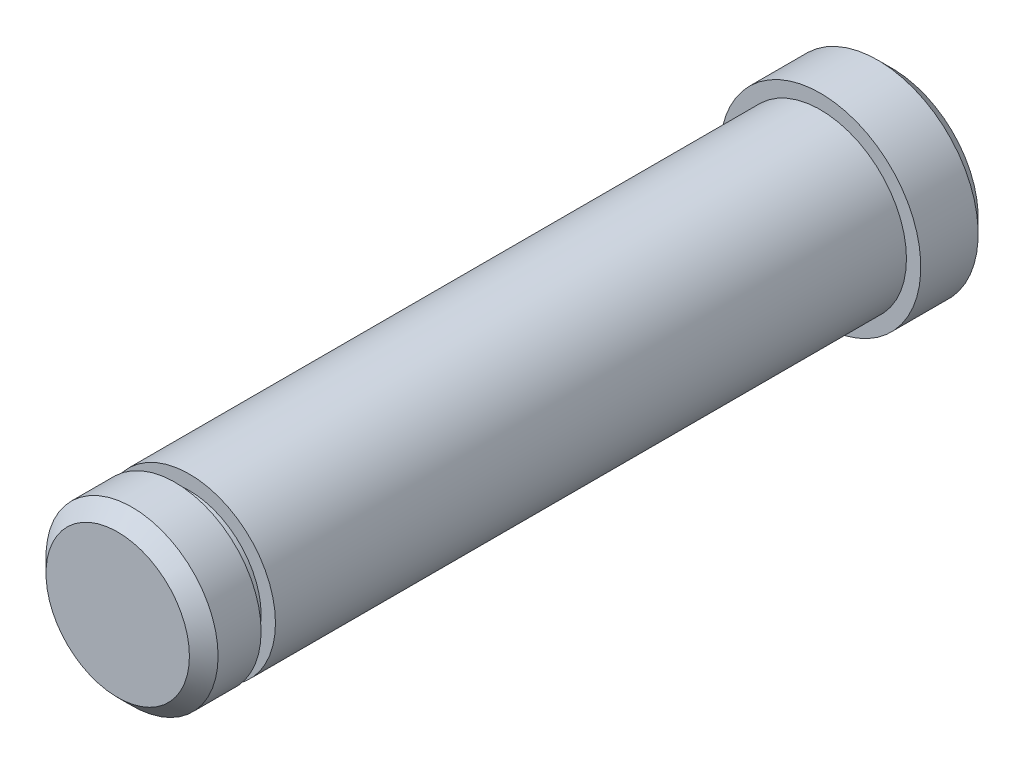
from build123d import *

# Parameters (mm, degrees)
SKETCH1_R           = 6
BOSS_EXTRUDE1_DEPTH = 44
SKETCH2_R           = 7
BOSS_EXTRUDE2_DEPTH = 5
SKETCH3_R           = 5
BOSS_EXTRUDE3_DEPTH = 1
SKETCH4_R           = 6
BOSS_EXTRUDE4_DEPTH = 4
CHAMFER1_SIZE       = 1


with BuildPart() as part:
    # Sketch1 → Boss-Extrude1 (new body)
    with BuildSketch(Plane.XY):
        Circle(SKETCH1_R)
    extrude(amount=BOSS_EXTRUDE1_DEPTH)

    # Sketch2 → Boss-Extrude2 (add)
    with BuildSketch(Plane(origin=(0, 0, 0), x_dir=(-1, 0, 0), z_dir=(0, 0, -1))):
        Circle(SKETCH2_R)
    extrude(amount=BOSS_EXTRUDE2_DEPTH)

    # Sketch3 → Boss-Extrude3 (add)
    with BuildSketch(Plane.XY.offset(44)):
        Circle(SKETCH3_R)
    extrude(amount=BOSS_EXTRUDE3_DEPTH)

    # Sketch4 → Boss-Extrude4 (add)
    with BuildSketch(Plane.XY.offset(45)):
        Circle(SKETCH4_R)
    extrude(amount=BOSS_EXTRUDE4_DEPTH)

    # Chamfer1
    chamfer1_edges = [part.edges().sort_by_distance(p)[0] for p in [
        (7, 0, -5),
        (-6, 0, 49),
    ]]
    chamfer(chamfer1_edges, length=CHAMFER1_SIZE)


solid = part.part
